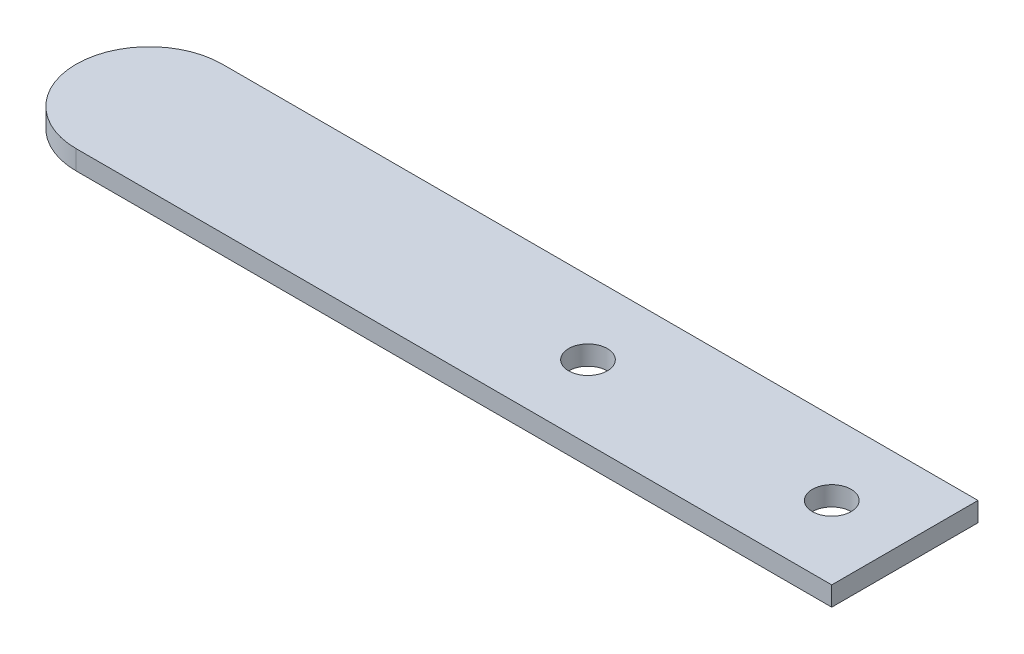
from build123d import *

# Parameters (mm, degrees)
SKETCH1_R           = 1.5875
BOSS_EXTRUDE1_DEPTH = 0.79375


with BuildPart() as part:
    # Sketch1 → Boss-Extrude1 (new, symmetric)
    with BuildSketch(Plane(origin=(0, 0, 0), x_dir=(1, 0, 0), z_dir=(0, 1, 0))):
        with BuildLine():
            Line((34, -6), (-28, -6))
            ThreePointArc((-28, -6), (-34, 0), (-28, 6))
            Line((-28, 6), (34, 6))
            Line((34, 6), (34, -6))
        make_face()
        with Locations((28, 0)):
            Circle(SKETCH1_R, mode=Mode.SUBTRACT)
        with Locations((8, 0)):
            Circle(SKETCH1_R, mode=Mode.SUBTRACT)
    extrude(amount=BOSS_EXTRUDE1_DEPTH, both=True)


solid = part.part
